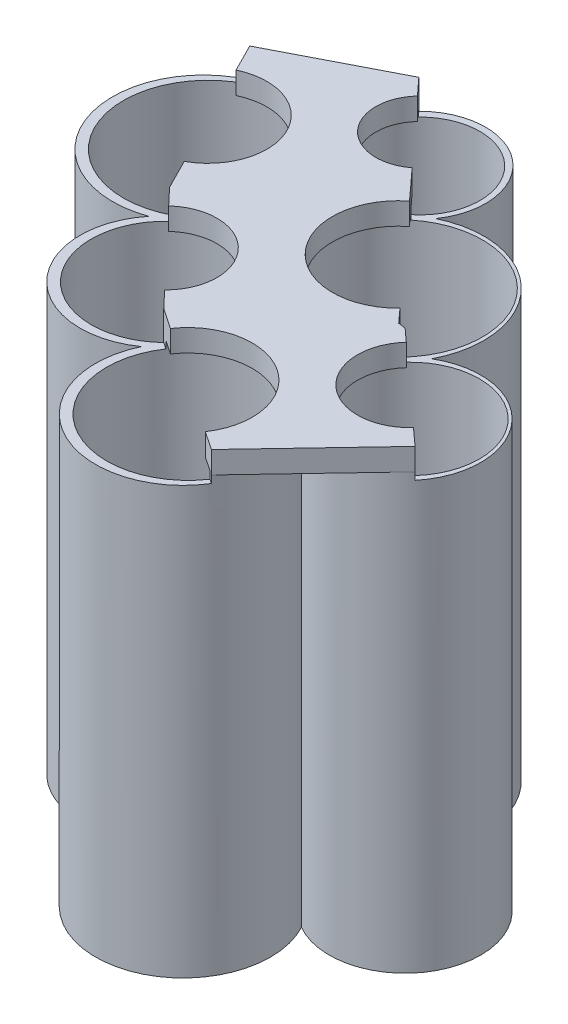
from build123d import *

# Parameters (mm, degrees)
SKETCH1_R                      = 12.3
SKETCH1_R_2                    = 11.9
SKETCH1_R_3                    = 10.3
SKETCH1_R_4                    = 10.95
SKETCH1_R_5                    = 12.35
SKETCH1_R_6                    = 9
BOSS_EXTRUDE4_DEPTH            = 59
SKETCH4_R                      = 8.15
SKETCH4_R_2                    = 11.5
SKETCH4_R_3                    = 10.1
SKETCH4_R_4                    = 11.05
SKETCH4_R_5                    = 11.45
SKETCH4_R_6                    = 9.45
CUT_EXTRUDE2_DEPTH             = 57
BOSS_EXTRUDE16_DEPTH           = 3
CUT_EXTRUDE3_START             = -1
CUT_EXTRUDE3_DEPTH             = 1
SKETCH1_8_R                    = 5
BOSS_EXTRUDE17_DEPTH           = 8
BOSS_EXTRUDE17_DRAFT           = 1
BOSS_EXTRUDE17_PROFILE_2_DEPTH = 8
BOSS_EXTRUDE17_PROFILE_2_DRAFT = 1
BOSS_EXTRUDE17_PROFILE_3_DEPTH = 8
BOSS_EXTRUDE17_PROFILE_3_DRAFT = 1
BOSS_EXTRUDE17_PROFILE_4_DEPTH = 8
BOSS_EXTRUDE17_PROFILE_4_DRAFT = 1
BOSS_EXTRUDE17_PROFILE_5_DEPTH = 8
BOSS_EXTRUDE17_PROFILE_5_DRAFT = 1
BOSS_EXTRUDE17_PROFILE_6_DEPTH = 8
BOSS_EXTRUDE17_PROFILE_6_DRAFT = 1
SKETCH8_R                      = 3.2
CUT_EXTRUDE4_DEPTH             = 8
FILLET14_R                     = 0.5


with BuildPart() as part:
    # Sketch1 → Boss-Extrude4 (new body)
    with BuildSketch(Plane(origin=(0, 0, 0), x_dir=(1, 0, 0), z_dir=(0, 1, 0))):
        with Locations((35.202950653, 27.384819692)):
            Circle(SKETCH1_R)
        with Locations((35.695437124, -1.701758227)):
            Circle(SKETCH1_R_2)
        with Locations((51.35120243, 12.814422837)):
            Circle(SKETCH1_R_3)
        with Locations((18.609876862, 12.337231774)):
            Circle(SKETCH1_R_4)
        with Locations((5.908756953, 30.848959221)):
            Circle(SKETCH1_R_5)
        with Locations((22.493671705, 43.629178782)):
            Circle(SKETCH1_R_6)
    extrude(amount=BOSS_EXTRUDE4_DEPTH)

    # Sketch4 → Cut-Extrude2 (cut)
    with BuildSketch(Plane(origin=(0, 59, 0), x_dir=(1, 0, 0), z_dir=(0, 1, 0))):
        with Locations((22.611280457, 43.589861599)):
            Circle(SKETCH4_R)
        with Locations((6.240064194, 31.151514878)):
            Circle(SKETCH4_R_2)
        with Locations((18.959017484, 12.652035772)):
            Circle(SKETCH4_R_3)
        with Locations((36.044577747, -1.386954229)):
            Circle(SKETCH4_R_4)
        with Locations((35.552091275, 27.69962369)):
            Circle(SKETCH4_R_5)
        with Locations((51.700343053, 13.129226835)):
            Circle(SKETCH4_R_6)
    extrude(amount=-CUT_EXTRUDE2_DEPTH, mode=Mode.SUBTRACT)

    # Sketch7 → Boss-Extrude16 (add)
    with BuildSketch(Plane(origin=(0, 59, 0), x_dir=(1, 0, 0), z_dir=(0, 1, 0))):
        with BuildLine():
            Line((12.096193963, 20.062275533), (14.227113378, 17.81043509))
            ThreePointArc((14.227113378, 17.81043509), (24.043394468, 17.463388044), (23.848660123, 7.642904623))
            Line((23.848660123, 7.642904623), (25.979579538, 5.39106418))
            Line((25.979579538, 5.39106418), (28.786327823, 3.500930556))
            ThreePointArc((28.786327823, 3.500930556), (40.932462533, 5.871295695), (43.302827672, -6.274839015))
            Line((43.302827672, -6.274839015), (45.813473599, -7.965569998))
            Line((45.813473599, -7.965569998), (59.286368882, 6.247602192))
            Line((59.286368882, 6.247602192), (56.972537505, 8.346582526))
            ThreePointArc((56.972537505, 8.346582526), (46.917698744, 7.857032383), (46.428148601, 17.911871144))
            Line((46.428148601, 17.911871144), (44.701133889, 19.478523732))
            Line((44.701133889, 19.478523732), (43.675498387, 19.630376086))
            Line((43.675498387, 19.630376086), (41.998986352, 21.48626504))
            ThreePointArc((41.998986352, 21.48626504), (28.907947097, 21.697654848), (30.02376287, 34.742766944))
            Line((30.02376287, 34.742766944), (28.347250835, 36.598655898))
            Line((28.347250835, 36.598655898), (26.285031376, 38.846070479))
            ThreePointArc((26.285031376, 38.846070479), (18.190403474, 39.533280933), (18.200134514, 47.657021722))
            Line((18.200134514, 47.657021722), (16.091652854, 49.954853025))
            Line((16.091652854, 49.954853025), (0.914458774, 42.144068149))
            Line((0.914458774, 42.144068149), (2.818929918, 38.383101167))
            ThreePointArc((2.818929918, 38.383101167), (13.377180684, 34.765594042), (10.044482029, 24.114014971))
            Line((10.044482029, 24.114014971), (12.096193963, 20.062275533))
        make_face()
    extrude(amount=BOSS_EXTRUDE16_DEPTH)

    # Sketch7<9> → Cut-Extrude3 (cut)
    with BuildSketch(Plane(origin=(0, 59, 0), x_dir=(1, 0, 0), z_dir=(0, 1, 0)).offset(CUT_EXTRUDE3_START)):
        with BuildLine():
            Line((26.879109941, 4.785298188), (25.979579538, 5.39106418))
            ThreePointArc((25.979579538, 5.39106418), (11.622987836, 5.709941779), (12.096193963, 20.062275533))
            Line((12.096193963, 20.062275533), (11.626038346, 20.990743134))
            ThreePointArc((11.626038346, 20.990743134), (-4.01954076, 25.956276079), (1.237373601, 41.506373005))
            Line((1.237373601, 41.506373005), (0.914458774, 42.144068149))
            ThreePointArc((0.914458774, 42.144068149), (-5.553505008, 26.251236881), (10.104320306, 19.233463185))
            ThreePointArc((10.104320306, 19.233463185), (10.62350673, 4.845877282), (24.948513457, 3.408391641))
            ThreePointArc((24.948513457, 3.408391641), (29.999769857, -12.150173149), (45.813473599, -7.965569998))
            Line((45.813473599, -7.965569998), (45.210045553, -7.559206647))
            ThreePointArc((45.210045553, -7.559206647), (29.87232533, -10.552422035), (26.879109941, 4.785298188))
        make_face()
        with BuildLine():
            Line((58.699552217, 6.779929938), (59.286368882, 6.247602192))
            ThreePointArc((59.286368882, 6.247602192), (59.179536281, 19.508240068), (46.096372921, 21.67313419))
            ThreePointArc((46.096372921, 21.67313419), (44.047275935, 35.932796664), (29.865700116, 38.466505337))
            ThreePointArc((29.865700116, 38.466505337), (28.258284683, 50.540708078), (16.091652854, 49.954853025))
            Line((16.091652854, 49.954853025), (16.74278999, 49.245241307))
            ThreePointArc((16.74278999, 49.245241307), (28.616305026, 49.100050336), (27.7423759, 37.257850895))
            Line((27.7423759, 37.257850895), (28.347250835, 36.598655898))
            ThreePointArc((28.347250835, 36.598655898), (44.048653588, 35.374969212), (43.675498387, 19.630376086))
            Line((43.675498387, 19.630376086), (44.701133889, 19.478523732))
            ThreePointArc((44.701133889, 19.478523732), (58.04963995, 20.128435998), (58.699552217, 6.779929938))
        make_face()
    extrude(amount=CUT_EXTRUDE3_DEPTH, mode=Mode.SUBTRACT)


with BuildPart() as boss_extrude17_tool:
    # Sketch1<8> → Boss-Extrude17 (with draft: the straight prism first)
    with BuildSketch(Plane(origin=(0, 0, 0), x_dir=(1, 0, 0), z_dir=(0, 1, 0))):
        with Locations((35.695437124, -1.701758227)):
            Circle(SKETCH1_8_R)
    extrude(amount=BOSS_EXTRUDE17_DEPTH)
    # Boss-Extrude17: the draft: its side faces are tilted about the plane it starts from
    boss_extrude17_sides = [boss_extrude17_tool.faces().sort_by_distance(p)[0] for p in [
        (30.695437124, 4, 1.701758227),
    ]]
    draft(boss_extrude17_sides, Plane(origin=(0, 0, 0), x_dir=(1, 0, 0), z_dir=(0, 1, 0)), BOSS_EXTRUDE17_DRAFT)


with BuildPart() as part_1:
    add(part.part)

    # Boss-Extrude17: add boss_extrude17_tool
    add(boss_extrude17_tool.part)


with BuildPart() as boss_extrude17_profile_2_tool:
    # Sketch1<8> → Boss-Extrude17 profile 2 (with draft: the straight prism first)
    with BuildSketch(Plane(origin=(0, 0, 0), x_dir=(1, 0, 0), z_dir=(0, 1, 0))):
        with Locations((18.609876862, 12.337231774)):
            Circle(SKETCH1_8_R)
    extrude(amount=BOSS_EXTRUDE17_PROFILE_2_DEPTH)
    # Boss-Extrude17 profile 2: the draft: its side faces are tilted about the plane it starts from
    boss_extrude17_profile_2_sides = [boss_extrude17_profile_2_tool.faces().sort_by_distance(p)[0] for p in [
        (13.609876862, 4, -12.337231774),
    ]]
    draft(boss_extrude17_profile_2_sides, Plane(origin=(0, 0, 0), x_dir=(1, 0, 0), z_dir=(0, 1, 0)), BOSS_EXTRUDE17_PROFILE_2_DRAFT)


with BuildPart() as part_2:
    add(part_1.part)

    # Boss-Extrude17 profile 2: add boss_extrude17_profile_2_tool
    add(boss_extrude17_profile_2_tool.part)


with BuildPart() as boss_extrude17_profile_3_tool:
    # Sketch1<8> → Boss-Extrude17 profile 3 (with draft: the straight prism first)
    with BuildSketch(Plane(origin=(0, 0, 0), x_dir=(1, 0, 0), z_dir=(0, 1, 0))):
        with Locations((5.908756953, 30.848959221)):
            Circle(SKETCH1_8_R)
    extrude(amount=BOSS_EXTRUDE17_PROFILE_3_DEPTH)
    # Boss-Extrude17 profile 3: the draft: its side faces are tilted about the plane it starts from
    boss_extrude17_profile_3_sides = [boss_extrude17_profile_3_tool.faces().sort_by_distance(p)[0] for p in [
        (0.908756953, 4, -30.848959221),
    ]]
    draft(boss_extrude17_profile_3_sides, Plane(origin=(0, 0, 0), x_dir=(1, 0, 0), z_dir=(0, 1, 0)), BOSS_EXTRUDE17_PROFILE_3_DRAFT)


with BuildPart() as part_3:
    add(part_2.part)

    # Boss-Extrude17 profile 3: add boss_extrude17_profile_3_tool
    add(boss_extrude17_profile_3_tool.part)


with BuildPart() as boss_extrude17_profile_4_tool:
    # Sketch1<8> → Boss-Extrude17 profile 4 (with draft: the straight prism first)
    with BuildSketch(Plane(origin=(0, 0, 0), x_dir=(1, 0, 0), z_dir=(0, 1, 0))):
        with Locations((22.493671705, 43.629178782)):
            Circle(SKETCH1_8_R)
    extrude(amount=BOSS_EXTRUDE17_PROFILE_4_DEPTH)
    # Boss-Extrude17 profile 4: the draft: its side faces are tilted about the plane it starts from
    boss_extrude17_profile_4_sides = [boss_extrude17_profile_4_tool.faces().sort_by_distance(p)[0] for p in [
        (17.493671705, 4, -43.629178782),
    ]]
    draft(boss_extrude17_profile_4_sides, Plane(origin=(0, 0, 0), x_dir=(1, 0, 0), z_dir=(0, 1, 0)), BOSS_EXTRUDE17_PROFILE_4_DRAFT)


with BuildPart() as part_4:
    add(part_3.part)

    # Boss-Extrude17 profile 4: add boss_extrude17_profile_4_tool
    add(boss_extrude17_profile_4_tool.part)


with BuildPart() as boss_extrude17_profile_5_tool:
    # Sketch1<8> → Boss-Extrude17 profile 5 (with draft: the straight prism first)
    with BuildSketch(Plane(origin=(0, 0, 0), x_dir=(1, 0, 0), z_dir=(0, 1, 0))):
        with Locations((35.202950653, 27.384819692)):
            Circle(SKETCH1_8_R)
    extrude(amount=BOSS_EXTRUDE17_PROFILE_5_DEPTH)
    # Boss-Extrude17 profile 5: the draft: its side faces are tilted about the plane it starts from
    boss_extrude17_profile_5_sides = [boss_extrude17_profile_5_tool.faces().sort_by_distance(p)[0] for p in [
        (30.202950653, 4, -27.384819692),
    ]]
    draft(boss_extrude17_profile_5_sides, Plane(origin=(0, 0, 0), x_dir=(1, 0, 0), z_dir=(0, 1, 0)), BOSS_EXTRUDE17_PROFILE_5_DRAFT)


with BuildPart() as part_5:
    add(part_4.part)

    # Boss-Extrude17 profile 5: add boss_extrude17_profile_5_tool
    add(boss_extrude17_profile_5_tool.part)


with BuildPart() as boss_extrude17_profile_6_tool:
    # Sketch1<8> → Boss-Extrude17 profile 6 (with draft: the straight prism first)
    with BuildSketch(Plane(origin=(0, 0, 0), x_dir=(1, 0, 0), z_dir=(0, 1, 0))):
        with Locations((51.35120243, 12.814422837)):
            Circle(SKETCH1_8_R)
    extrude(amount=BOSS_EXTRUDE17_PROFILE_6_DEPTH)
    # Boss-Extrude17 profile 6: the draft: its side faces are tilted about the plane it starts from
    boss_extrude17_profile_6_sides = [boss_extrude17_profile_6_tool.faces().sort_by_distance(p)[0] for p in [
        (46.35120243, 4, -12.814422837),
    ]]
    draft(boss_extrude17_profile_6_sides, Plane(origin=(0, 0, 0), x_dir=(1, 0, 0), z_dir=(0, 1, 0)), BOSS_EXTRUDE17_PROFILE_6_DRAFT)


with BuildPart() as part_6:
    add(part_5.part)

    # Boss-Extrude17 profile 6: add boss_extrude17_profile_6_tool
    add(boss_extrude17_profile_6_tool.part)

    # Sketch8 → Cut-Extrude4 (cut)
    with BuildSketch(Plane.XZ):
        with Locations((35.695437124, 1.701758227)):
            Circle(SKETCH8_R)
        with Locations((51.35120243, -12.814422837)):
            Circle(SKETCH8_R)
        with Locations((35.202950653, -27.384819692)):
            Circle(SKETCH8_R)
        with Locations((18.609876862, -12.337231774)):
            Circle(SKETCH8_R)
        with Locations((5.908756953, -30.848959221)):
            Circle(SKETCH8_R)
        with Locations((22.493671705, -43.629178782)):
            Circle(SKETCH8_R)
    extrude(amount=-CUT_EXTRUDE4_DEPTH, mode=Mode.SUBTRACT)

    # Fillet14
    fillet14_edges = [part_6.edges().sort_by_distance(p)[0] for p in [
        (17.633312224, 8, -43.629178782),
        (1.048397473, 8, -30.848959221),
        (30.835077644, 8, 1.701758227),
        (13.749517381, 8, -12.337231774),
        (46.49084295, 8, -12.814422837),
        (30.342591172, 8, -27.384819692),
    ]]
    fillet(fillet14_edges, radius=FILLET14_R)


solid = part_6.part
